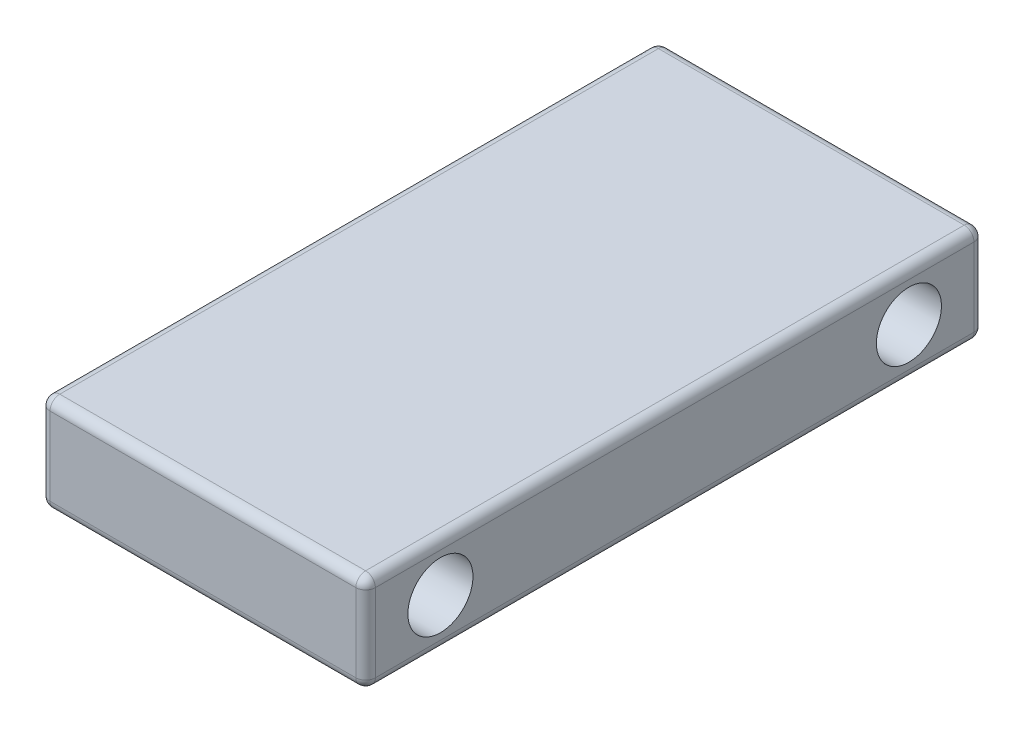
from build123d import *

# Parameters (mm, degrees)
SKETCH2_W           = 508
SKETCH2_H           = 965.2
BOSS_EXTRUDE1_DEPTH = 152.4
FILLET1_R           = 15.24
FILLET2_R           = 15.24
SKETCH5_R           = 50.8
CUT_EXTRUDE1_DEPTH  = 718.072186045


with BuildPart() as part:
    # Sketch2 → Boss-Extrude1 (new body)
    with BuildSketch(Plane(origin=(0, 0, 0), x_dir=(1, 0, 0), z_dir=(0, 1, 0))):
        Rectangle(SKETCH2_W, SKETCH2_H)
    extrude(amount=BOSS_EXTRUDE1_DEPTH)

    # Fillet1
    fillet1_edges = [part.edges().sort_by_distance(p)[0] for p in [
        (-254, 152.4, 0),
        (0, 152.4, 482.6),
        (254, 152.4, 0),
        (0, 152.4, -482.6),
    ]]
    fillet(fillet1_edges, radius=FILLET1_R)

    # Fillet2
    # the kernel refuses this fillet: 15.24 mm, written as the material it takes off along each edge
    with BuildSketch(Plane(origin=(238.76, 137.16, -467.36), x_dir=(1, 0, 0), z_dir=(0, 0, -1))) as fillet2_piece_1_section:
        Polygon((0, 0), (FILLET2_R, 0), (FILLET2_R, -FILLET2_R), (0, -FILLET2_R), align=None)
    fillet2_piece_1 = extrude(amount=FILLET2_R, mode=Mode.PRIVATE)
    fillet2_piece_1 = fillet2_piece_1 - Plane(origin=(238.76, 137.16, -467.36), x_dir=(-0.7071067811865475, -0.7071067811865475, 0), z_dir=(0, 0, -1)) * Sphere(FILLET2_R, mode=Mode.PRIVATE)
    add(fillet2_piece_1, mode=Mode.SUBTRACT)
    with BuildSketch(Plane(origin=(238.76, 137.16, 467.36), x_dir=(0, 0, 1), z_dir=(1, 0, 0))) as fillet2_piece_2_section:
        Polygon((0, 0), (FILLET2_R, 0), (FILLET2_R, -FILLET2_R), (0, -FILLET2_R), align=None)
    fillet2_piece_2 = extrude(amount=FILLET2_R, mode=Mode.PRIVATE)
    fillet2_piece_2 = fillet2_piece_2 - Plane(origin=(238.76, 137.16, 467.36), x_dir=(0, -0.7071067811865475, -0.7071067811865475), z_dir=(1, 0, 0)) * Sphere(FILLET2_R, mode=Mode.PRIVATE)
    add(fillet2_piece_2, mode=Mode.SUBTRACT)
    with BuildSketch(Plane(origin=(-238.76, 137.16, -467.36), x_dir=(-1, 0, 0), z_dir=(0, 0, -1))) as fillet2_piece_3_section:
        Polygon((0, 0), (FILLET2_R, 0), (FILLET2_R, FILLET2_R), (0, FILLET2_R), align=None)
    fillet2_piece_3 = extrude(amount=FILLET2_R, mode=Mode.PRIVATE)
    fillet2_piece_3 = fillet2_piece_3 - Plane(origin=(-238.76, 137.16, -467.36), x_dir=(0.7071067811865475, -0.7071067811865475, 0), z_dir=(0, 0, -1)) * Sphere(FILLET2_R, mode=Mode.PRIVATE)
    add(fillet2_piece_3, mode=Mode.SUBTRACT)
    with BuildSketch(Plane(origin=(-238.76, 137.16, 467.36), x_dir=(0, 0, 1), z_dir=(-1, 0, 0))) as fillet2_piece_4_section:
        Polygon((0, 0), (FILLET2_R, 0), (FILLET2_R, FILLET2_R), (0, FILLET2_R), align=None)
    fillet2_piece_4 = extrude(amount=FILLET2_R, mode=Mode.PRIVATE)
    fillet2_piece_4 = fillet2_piece_4 - Plane(origin=(-238.76, 137.16, 467.36), x_dir=(0, -0.7071067811865475, -0.7071067811865475), z_dir=(-1, 0, 0)) * Sphere(FILLET2_R, mode=Mode.PRIVATE)
    add(fillet2_piece_4, mode=Mode.SUBTRACT)
    with BuildSketch(Plane(origin=(-238.76, 15.24, 467.36), x_dir=(0, -1, 0), z_dir=(-1, 0, 0))) as fillet2_piece_5_section:
        Polygon((0, 0), (FILLET2_R, 0), (FILLET2_R, FILLET2_R), (0, FILLET2_R), align=None)
    fillet2_piece_5 = extrude(amount=FILLET2_R, mode=Mode.PRIVATE)
    fillet2_piece_5 = fillet2_piece_5 - Plane(origin=(-238.76, 15.24, 467.36), x_dir=(0, 0.7071067811865475, -0.7071067811865475), z_dir=(-1, 0, 0)) * Sphere(FILLET2_R, mode=Mode.PRIVATE)
    add(fillet2_piece_5, mode=Mode.SUBTRACT)
    with BuildSketch(Plane(origin=(-238.76, 15.24, -467.36), x_dir=(-1, 0, 0), z_dir=(0, 0, -1))) as fillet2_piece_6_section:
        Polygon((0, 0), (FILLET2_R, 0), (FILLET2_R, -FILLET2_R), (0, -FILLET2_R), align=None)
    fillet2_piece_6 = extrude(amount=FILLET2_R, mode=Mode.PRIVATE)
    fillet2_piece_6 = fillet2_piece_6 - Plane(origin=(-238.76, 15.24, -467.36), x_dir=(0.7071067811865475, 0.7071067811865475, 0), z_dir=(0, 0, -1)) * Sphere(FILLET2_R, mode=Mode.PRIVATE)
    add(fillet2_piece_6, mode=Mode.SUBTRACT)
    with BuildSketch(Plane(origin=(238.76, 15.24, 467.36), x_dir=(1, 0, 0), z_dir=(0, -1, 0))) as fillet2_piece_7_section:
        Polygon((0, 0), (FILLET2_R, 0), (FILLET2_R, FILLET2_R), (0, FILLET2_R), align=None)
    fillet2_piece_7 = extrude(amount=FILLET2_R, mode=Mode.PRIVATE)
    fillet2_piece_7 = fillet2_piece_7 - Plane(origin=(238.76, 15.24, 467.36), x_dir=(-0.7071067811865477, 0, -0.7071067811865474), z_dir=(0, -1, 0)) * Sphere(FILLET2_R, mode=Mode.PRIVATE)
    add(fillet2_piece_7, mode=Mode.SUBTRACT)
    with BuildSketch(Plane(origin=(238.76, 15.24, -467.36), x_dir=(0, -1, 0), z_dir=(0, 0, -1))) as fillet2_piece_8_section:
        Polygon((0, 0), (FILLET2_R, 0), (FILLET2_R, -FILLET2_R), (0, -FILLET2_R), align=None)
    fillet2_piece_8 = extrude(amount=FILLET2_R, mode=Mode.PRIVATE)
    fillet2_piece_8 = fillet2_piece_8 - Plane(origin=(238.76, 15.24, -467.36), x_dir=(-0.7071067811865475, 0.7071067811865475, 0), z_dir=(0, 0, -1)) * Sphere(FILLET2_R, mode=Mode.PRIVATE)
    add(fillet2_piece_8, mode=Mode.SUBTRACT)
    with BuildSketch(Plane(origin=(-254, 15.24, 482.6), x_dir=(0, 0, -1), z_dir=(0, 1, 0)), Plane(origin=(-254, 15.24, -482.6), x_dir=(1, 0, 0), z_dir=(0, 1, 0))) as fillet2_piece_9:
        with BuildLine():
            CenterArc((FILLET2_R, -FILLET2_R), FILLET2_R, 90, 90)
            Line((0, -FILLET2_R), (0, 0))
            Line((0, 0), (FILLET2_R, 0))
        make_face()
    extrude(amount=121.92, mode=Mode.SUBTRACT)
    with BuildSketch(Plane(origin=(254, 15.24, 482.6), x_dir=(0, 0, -1), z_dir=(0, 1, 0)), Plane(origin=(254, 15.24, -482.6), x_dir=(-1, 0, 0), z_dir=(0, 1, 0))) as fillet2_piece_10:
        with BuildLine():
            CenterArc((FILLET2_R, FILLET2_R), FILLET2_R, 180, 90)
            Line((0, FILLET2_R), (0, 0))
            Line((0, 0), (FILLET2_R, 0))
        make_face()
    extrude(amount=121.92, mode=Mode.SUBTRACT)
    with BuildSketch(Plane(origin=(238.76, 0, 482.6), x_dir=(0, 0, -1), z_dir=(-1, 0, 0))) as fillet2_piece_11:
        with BuildLine():
            CenterArc((FILLET2_R, -FILLET2_R), FILLET2_R, 90, 90)
            Line((0, -FILLET2_R), (0, 0))
            Line((0, 0), (FILLET2_R, 0))
        make_face()
    extrude(amount=477.52, mode=Mode.SUBTRACT)
    with BuildSketch(Plane(origin=(-254, 0, 467.36), x_dir=(0, 1, 0), z_dir=(0, 0, -1))) as fillet2_piece_12:
        with BuildLine():
            CenterArc((FILLET2_R, FILLET2_R), FILLET2_R, 180, 90)
            Line((0, FILLET2_R), (0, 0))
            Line((0, 0), (FILLET2_R, 0))
        make_face()
    extrude(amount=934.72, mode=Mode.SUBTRACT)
    with BuildSketch(Plane(origin=(-238.76, 0, -482.6), x_dir=(0, 1, 0), z_dir=(1, 0, 0))) as fillet2_piece_13:
        with BuildLine():
            CenterArc((FILLET2_R, FILLET2_R), FILLET2_R, 180, 90)
            Line((0, FILLET2_R), (0, 0))
            Line((0, 0), (FILLET2_R, 0))
        make_face()
    extrude(amount=477.52, mode=Mode.SUBTRACT)
    with BuildSketch(Plane(origin=(254, 0, -467.36), x_dir=(-1, 0, 0), z_dir=(0, 0, 1))) as fillet2_piece_14:
        with BuildLine():
            CenterArc((FILLET2_R, -FILLET2_R), FILLET2_R, 90, 90)
            Line((0, -FILLET2_R), (0, 0))
            Line((0, 0), (FILLET2_R, 0))
        make_face()
    extrude(amount=934.72, mode=Mode.SUBTRACT)

    # Sketch5 → Cut-Extrude1 (cut, through all)
    with BuildSketch(Plane.ZY.offset(254)):
        with Locations((-365.76, 76.2)):
            Circle(SKETCH5_R)
        with Locations(Location((365.76, 76.2, 0), (0, 0, 180))):
            Circle(SKETCH5_R)
    extrude(amount=-CUT_EXTRUDE1_DEPTH, mode=Mode.SUBTRACT)


solid = part.part
